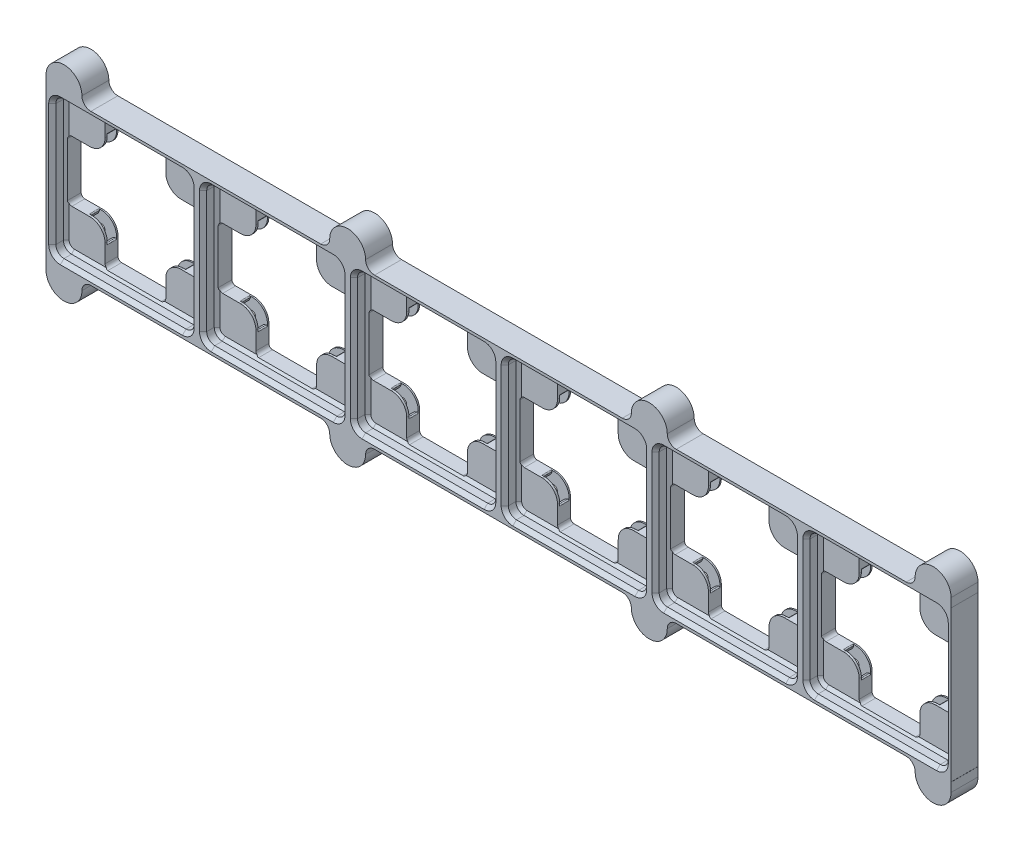
from build123d import *

# Parameters (mm, degrees)
MAGNET_SLOT_DEPTH   = 2.6
MAGNET_TOPPER_DEPTH = 0.6
BOTTOM_START        = 0.4
BOTTOM_DEPTH        = 0.4
CUT_EXTRUDE1_REACH  = 31.916
FILLET1_R           = 1
BOSS_EXTRUDE1_DEPTH = 3.9
CHAMFER1_SIZE       = 0.8
CHAMFER2_SIZE       = 1
CIRPATTERN1_COUNT   = 4
LPATTERN2_COUNT     = 6
LPATTERN2_PITCH     = 42
BOSS_EXTRUDE6_DEPTH = 7.5
SKETCH28_R          = 2.5
CUT_EXTRUDE6_DEPTH  = 6.5
FILLET12_R          = 2.5


with BuildPart() as part:
    # Sketch1 → Magnet Slot (new body)
    with BuildSketch(Plane.XY):
        with BuildLine():
            Line((-21, 0), (-18.7, 0))
            Line((-18.7, 0), (-18.7, 8.45))
            Line((-18.7, 8.45), (-13.423469406, 8.45))
            ThreePointArc((-13.423469406, 8.45), (-13.215070921, 8.56190557), (-13.193240046, 8.797439428))
            Line((-13.193240046, 8.797439428), (-13.513172798, 9.553374824))
            ThreePointArc((-13.513172798, 9.553374824), (-14.998097039, 14.998097039), (-9.553374824, 13.513172798))
            Line((-9.553374824, 13.513172798), (-8.797439428, 13.193240046))
            ThreePointArc((-8.797439428, 13.193240046), (-8.56190557, 13.215070921), (-8.45, 13.423469406))
            Line((-8.45, 13.423469406), (-8.45, 18.7))
            Line((-8.45, 18.7), (0, 18.7))
            Line((0, 18.7), (0, 21))
            Line((0, 21), (-21, 21))
            Line((-21, 21), (-21, 0))
        make_face()
    extrude(amount=MAGNET_SLOT_DEPTH)

    # Sketch2 → Magnet Topper (add)
    with BuildSketch(Plane.XY.offset(2.6)):
        with BuildLine():
            Line((-12.7, 8.45), (-18.7, 8.45))
            Line((-18.7, 8.45), (-18.7, 0))
            Line((-18.7, 0), (-21, 0))
            Line((-21, 0), (-21, 21))
            Line((-21, 21), (0, 21))
            Line((0, 21), (0, 18.7))
            Line((0, 18.7), (-8.45, 18.7))
            Line((-8.45, 18.7), (-8.45, 12.7))
            ThreePointArc((-8.45, 12.7), (-9.69479618, 9.69479618), (-12.7, 8.45))
        make_face()
    extrude(amount=MAGNET_TOPPER_DEPTH)

    # Sketch3 → Bottom (add)
    with BuildSketch(Plane(origin=(0, 0, 0), x_dir=(-1, 0, 0), z_dir=(0, 0, -1)).offset(BOTTOM_START)):
        with BuildLine():
            Line((18.7, 8.45), (18.7, 0))
            Line((18.7, 0), (21, 0))
            Line((21, 0), (21, 21))
            Line((21, 21), (0, 21))
            Line((0, 21), (0, 18.7))
            Line((0, 18.7), (8.45, 18.7))
            Line((8.45, 18.7), (8.45, 12.7))
            ThreePointArc((8.45, 12.7), (9.69479618, 9.69479618), (12.7, 8.45))
            Line((12.7, 8.45), (18.7, 8.45))
        make_face()
    extrude(amount=-BOTTOM_DEPTH)

    # Cut-Extrude1: up to this face of the body (flat: up to its plane)
    cut_extrude1_end = Plane(part.part.faces().sort_by_distance((-12.297393308, 12.297393308, 2.6))[0])
    # Sketch4 → Cut-Extrude1 (cut, up to the picked face)
    with BuildSketch(Plane(origin=(0, 0, -0.4), x_dir=(-1, 0, 0), z_dir=(0, 0, -1)), mode=Mode.PRIVATE) as cut_extrude1_sk1:
        with BuildLine():
            Line((11.992893219, 13.407106781), (15.528427125, 16.942640687))
            ThreePointArc((15.528427125, 16.942640687), (16.942640687, 16.942640687), (16.942640687, 15.528427125))
            Line((16.942640687, 15.528427125), (13.407106781, 11.992893219))
            ThreePointArc((13.407106781, 11.992893219), (11.992893219, 11.992893219), (11.992893219, 13.407106781))
        make_face()
    cut_extrude1_tool1 = split(extrude(cut_extrude1_sk1.sketch, amount=-CUT_EXTRUDE1_REACH, mode=Mode.PRIVATE), bisect_by=cut_extrude1_end, keep=Keep.BOTH, mode=Mode.PRIVATE)
    add(cut_extrude1_tool1.solids().sort_by(Axis((-14.467767, 14.467767, -0.4), (0, 0, 1)))[0], mode=Mode.SUBTRACT)

    # Fillet1
    fillet1_edges = [part.edges().sort_by_distance(p)[0] for p in [
        (-8.45, 18.7, 1.4),
        (-18.7, 8.45, 1.4),
    ]]
    fillet(fillet1_edges, radius=FILLET1_R)

    # Sketch5 → Boss-Extrude1 (add)
    with BuildSketch(Plane.XY.offset(3.2)):
        with BuildLine():
            Line((0, 21), (-17.25, 21))
            Line((-17.25, 21), (-21, 21))
            Line((-21, 21), (-21, 17.25))
            Line((-21, 17.25), (-21, 0))
            Line((-21, 0), (-19.25, 0))
            Line((-19.25, 0), (-19.25, 17))
            ThreePointArc((-19.25, 17), (-18.590990258, 18.590990258), (-17, 19.25))
            Line((-17, 19.25), (0, 19.25))
            Line((0, 19.25), (0, 21))
        make_face()
    extrude(amount=BOSS_EXTRUDE1_DEPTH)

    # Chamfer1
    chamfer1_edges = [part.edges().sort_by_distance(p)[0] for p in [
        (-19.25, 8.5, 3.2),
        (-18.590990258, 18.590990258, 3.2),
        (-8.5, 19.25, 3.2),
    ]]
    chamfer(chamfer1_edges, length=CHAMFER1_SIZE)

    # Chamfer2
    chamfer2_edges = [part.edges().sort_by_distance(p)[0] for p in [
        (-19.25, 8.5, 7.1),
        (-18.590990258, 18.590990258, 7.1),
        (-8.5, 19.25, 7.1),
    ]]
    chamfer(chamfer2_edges, length=CHAMFER2_SIZE)


with BuildPart() as cirpattern1_1:
    # CirPattern1: pattern copy
    add(part.part.rotate(Axis((0, 0, 0), (0, 0, 1)), 1 * 360 / CIRPATTERN1_COUNT))


with BuildPart() as cirpattern1_2:
    # CirPattern1: pattern copy
    add(part.part.rotate(Axis((0, 0, 0), (0, 0, 1)), 2 * 360 / CIRPATTERN1_COUNT))


with BuildPart() as cirpattern1_3:
    # CirPattern1: pattern copy
    add(part.part.rotate(Axis((0, 0, 0), (0, 0, 1)), 3 * 360 / CIRPATTERN1_COUNT))


with BuildPart() as part_1:
    add(part.part)

    # Combine1: union CirPattern1_3, CirPattern1_1, CirPattern1_2
    add(cirpattern1_3.part)
    add(cirpattern1_1.part)
    add(cirpattern1_2.part)


with BuildPart() as lpattern2_1:
    # LPattern2: pattern copy
    add(part_1.part.moved(Location(Vector(1, 0, 0) * (1 * LPATTERN2_PITCH))))


with BuildPart() as lpattern2_2:
    # LPattern2: pattern copy
    add(part_1.part.moved(Location(Vector(1, 0, 0) * (2 * LPATTERN2_PITCH))))


with BuildPart() as lpattern2_3:
    # LPattern2: pattern copy
    add(part_1.part.moved(Location(Vector(1, 0, 0) * (3 * LPATTERN2_PITCH))))


with BuildPart() as lpattern2_4:
    # LPattern2: pattern copy
    add(part_1.part.moved(Location(Vector(1, 0, 0) * (4 * LPATTERN2_PITCH))))


with BuildPart() as lpattern2_5:
    # LPattern2: pattern copy
    add(part_1.part.moved(Location(Vector(1, 0, 0) * (5 * LPATTERN2_PITCH))))


with BuildPart() as part_2:
    add(part_1.part)

    # Combine2: union LPattern2_5, LPattern2_4, LPattern2_3, LPattern2_2, LPattern2_1
    add(lpattern2_5.part)
    add(lpattern2_4.part)
    add(lpattern2_3.part)
    add(lpattern2_2.part)
    add(lpattern2_1.part)

    # Sketch27 → Boss-Extrude6 (add)
    with BuildSketch(Plane.XY.offset(7.1)):
        with BuildLine():
            Line((-21, -21), (-21, -23.5))
            ThreePointArc((-21, -23.5), (-16, -28.5), (-11, -23.5))
            Line((-11, -23.5), (-11, -21))
            Line((-11, -21), (-21, -21))
        make_face()
        with BuildLine():
            Line((68, -23.5), (68, -21))
            Line((68, -21), (58, -21))
            Line((58, -21), (58, -23.5))
            ThreePointArc((58, -23.5), (63, -28.5), (68, -23.5))
        make_face()
        with BuildLine():
            Line((142, -21), (142, -23.5))
            ThreePointArc((142, -23.5), (147, -28.5), (152, -23.5))
            Line((152, -23.5), (152, -21))
            Line((152, -21), (142, -21))
        make_face()
        with BuildLine():
            Line((221.02860347, -21), (221.02860347, -23.5))
            ThreePointArc((221.02860347, -23.5), (226.02860347, -28.5), (231.02860347, -23.5))
            Line((231.02860347, -23.5), (231.02860347, -21))
            Line((231.02860347, -21), (221.02860347, -21))
        make_face()
    boss_extrude6 = extrude(amount=-BOSS_EXTRUDE6_DEPTH)

    # Sketch28 → Cut-Extrude6 (cut)
    with BuildSketch(Plane(origin=(0, 0, -0.4), x_dir=(-1, 0, 0), z_dir=(0, 0, -1))):
        with Locations((-226.02860347, -23.5)):
            Circle(SKETCH28_R)
        with Locations((-147, -23.5)):
            Circle(SKETCH28_R)
        with Locations((-63, -23.5)):
            Circle(SKETCH28_R)
        with Locations((16, -23.5)):
            Circle(SKETCH28_R)
    cut_extrude6 = extrude(amount=-CUT_EXTRUDE6_DEPTH, mode=Mode.SUBTRACT)

    # Mirror7: Boss-Extrude6, Cut-Extrude6 across plane
    add(boss_extrude6.mirror(Plane(origin=(0, 0, 0), x_dir=(0, 0, 1), z_dir=(0, -1, 0))))
    add(cut_extrude6.mirror(Plane(origin=(0, 0, 0), x_dir=(0, 0, 1), z_dir=(0, -1, 0))), mode=Mode.SUBTRACT)

    # Fillet12
    fillet12_edges = [part_2.edges().sort_by_distance(p)[0] for p in [
        (221.02860347, -21, 3.35),
        (152, -21, 3.35),
        (142, -21, 3.35),
        (68, -21, 3.35),
        (58, -21, 3.35),
        (-11, -21, 3.35),
        (-11, 21, 3.35),
        (68, 21, 3.35),
        (58, 21, 3.35),
        (142, 21, 3.35),
        (152, 21, 3.35),
        (221.02860347, 21, 3.35),
    ]]
    fillet(fillet12_edges, radius=FILLET12_R - 0.0001)  # a hair under: the kernel refuses the full size


solid = part_2.part
